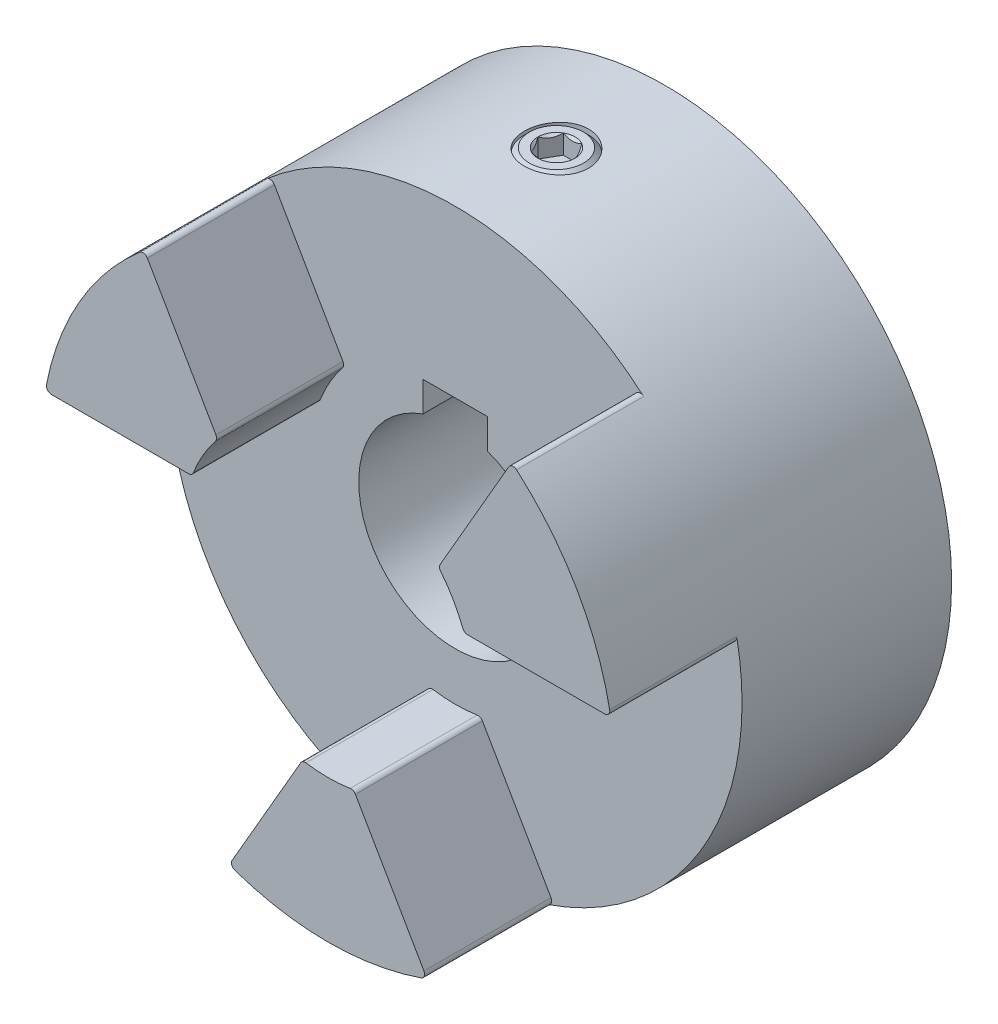
from build123d import *
from OCP.BRepFilletAPI import BRepFilletAPI_MakeChamfer

# Parameters (mm, degrees)
BOSS_EXTRUDE1_START      = -6.746875
SKETCH1_R                = 26.7890625
BOSS_EXTRUDE1_DEPTH      = 20.6375
BOSS_EXTRUDE2_DEPTH      = 11.8618
FILLET1_R                = 0.476990821
CIRPATTERN1_COUNT        = 3
FILLET1_OF_CIRPATTERN1_R = 0.476990821
CUT_EXTRUDE5_DEPTH       = 47.746248335
CUT_EXTRUDE5_DEPTH_BACK  = 47.746248335
SKETCH15_R               = 9
CHAMFER1_SIZE            = 1.0715625
CHAMFER1_SIZE2           = 1.588656738
CUT_EXTRUDE1_DEPTH       = 47.746248335
CUT_EXTRUDE1_DEPTH_BACK  = 47.746248335
SKETCH5_R                = 3
CUT_EXTRUDE2_DEPTH       = 47.746248335
SKETCH6_R                = 3
BOSS_EXTRUDE3_DEPTH      = 8
CUT_EXTRUDE3_DEPTH       = 1.8
CHAMFER3_SIZE            = 0.48
CHAMFER4_SIZE            = 1.02


with BuildPart() as part:
    # Sketch1 → Boss-Extrude1 (new body)
    with BuildSketch(Plane.XY.offset(BOSS_EXTRUDE1_START)):
        Circle(SKETCH1_R)
    extrude(amount=-BOSS_EXTRUDE1_DEPTH)

    # Sketch2 → Boss-Extrude2 (add)
    with BuildSketch(Plane.XY.offset(-6.746875)):
        with BuildLine():
            Line((-9.238549561, -25.145637229), (-2.384954104, -13.274861682))
            ThreePointArc((-2.384954104, -13.274861682), (0, -13.4874), (2.384954104, -13.274861682))
            Line((2.384954104, -13.274861682), (9.238549561, -25.145637229))
            ThreePointArc((9.238549561, -25.145637229), (0, -26.7890625), (-9.238549561, -25.145637229))
        make_face()
    boss_extrude2 = extrude(amount=BOSS_EXTRUDE2_DEPTH)

    # Fillet1
    # the kernel refuses this fillet: 0.476990821 mm, written as the material it takes off along each edge
    with BuildSketch(Plane(origin=(-9.238549561, -25.145637229, -6.746875), x_dir=(0.9423194959651416, -0.33471475546202245, 0), z_dir=(0, 0, 1))) as fillet1_piece_1:
        with BuildLine():
            CenterArc((0.572952448, 0.476963054), FILLET1_R, 169.55519331, 101.063030663)
            Line((0.103865366, 0.563435893), (0, 0))
            ThreePointArc((0, 0), (0.28904955, -0.001559444), (0.5780991, 0))
        make_face()
    extrude(amount=13.307047751, mode=Mode.SUBTRACT)
    with BuildSketch(Plane(origin=(9.238549561, -25.145637229, -6.746875), x_dir=(-0.9423194959651411, -0.3347147554620237, 0), z_dir=(0, 0, 1))) as fillet1_piece_2:
        with BuildLine():
            CenterArc((0.572952448, -0.476963054), FILLET1_R, 89.381776027, 101.063030663)
            Line((0.103865366, -0.563435893), (0, 0))
            ThreePointArc((0, 0), (0.28904955, 0.001559444), (0.5780991, 0))
        make_face()
    extrude(amount=13.307047751, mode=Mode.SUBTRACT)
    with BuildSketch(Plane(origin=(2.384954104, -13.274861682, -6.746875), x_dir=(0.49999999999999706, -0.8660254037844404, 0), z_dir=(0, 0, 1))) as fillet1_piece_3:
        with BuildLine():
            CenterArc((0.330829178, -0.476990821), FILLET1_R, 90, 68.803855098)
            ThreePointArc((-0.113892323, -0.304529143), (-0.056028498, -0.152607773), (0, 0))
            Line((0, 0), (0.330829178, 0))
        make_face()
    extrude(amount=12.688872944, mode=Mode.SUBTRACT)
    with BuildSketch(Plane(origin=(-2.384954104, -13.274861682, -6.746875), x_dir=(0.9863015455813384, -0.16495229972286882, 0), z_dir=(0, 0, 1))) as fillet1_piece_4:
        with BuildLine():
            CenterArc((0.330879129, -0.476956172), FILLET1_R, 90.690608377, 68.803855098)
            Line((-0.115888763, -0.309867293), (0, 0))
            ThreePointArc((0, 0), (0.162564956, -0.000979741), (0.325129912, 0))
        make_face()
    extrude(amount=12.688872944, mode=Mode.SUBTRACT)

    # CirPattern1: Boss-Extrude2 ×3 about axis
    cirpattern1_axis = Axis((0, 0, 0), (0, 0, 1))
    for i in range(1, CIRPATTERN1_COUNT):
        add(boss_extrude2.rotate(cirpattern1_axis, i * 360 / CIRPATTERN1_COUNT))

    # Fillet1 of CirPattern1
    # the kernel refuses this fillet: 0.476990821 mm, written as the material it takes off along each edge
    with BuildSketch(Plane(origin=(26.396035415, 4.572, -6.746875), x_dir=(-0.18128826673094764, 0.9834299997181745, 0), z_dir=(0, 0, 1)), Plane(origin=(-17.157485854, 20.573637229, -6.746875), x_dir=(-0.761031229234182, -0.6487152442561451, 0), z_dir=(0, 0, 1))) as fillet1_of_cirpattern1_piece_1:
        with BuildLine():
            CenterArc((0.572952448, 0.476963054), FILLET1_OF_CIRPATTERN1_R, 169.55519331, 101.063030663)
            Line((0.103865366, 0.563435893), (0, 0))
            ThreePointArc((0, 0), (0.28904955, -0.001559444), (0.5780991, 0))
        make_face()
    extrude(amount=13.307047751, mode=Mode.SUBTRACT)
    with BuildSketch(Plane(origin=(17.157485854, 20.573637229, -6.746875), x_dir=(0.7610312292341833, -0.6487152442561435, 0), z_dir=(0, 0, 1)), Plane(origin=(-26.396035415, 4.572, -6.746875), x_dir=(0.181288266730962, 0.9834299997181718, 0), z_dir=(0, 0, 1))) as fillet1_of_cirpattern1_piece_2:
        with BuildLine():
            CenterArc((0.572952448, -0.476963054), FILLET1_OF_CIRPATTERN1_R, 89.381776027, 101.063030663)
            Line((0.103865366, -0.563435893), (0, 0))
            ThreePointArc((0, 0), (0.28904955, 0.001559444), (0.5780991, 0))
        make_face()
    extrude(amount=13.307047751, mode=Mode.SUBTRACT)
    with BuildSketch(Plane(origin=(10.303890396, 8.702861682, -6.746875), x_dir=(0.5000000000000006, 0.8660254037844383, 0), z_dir=(0, 0, 1)), Plane(origin=(-12.688844501, 4.572, -6.746875), x_dir=(-1, 0, 0), z_dir=(0, 0, 1))) as fillet1_of_cirpattern1_piece_3:
        with BuildLine():
            CenterArc((0.330829178, -0.476990821), FILLET1_OF_CIRPATTERN1_R, 90, 68.803855098)
            ThreePointArc((-0.113892323, -0.304529143), (-0.056028498, -0.152607773), (0, 0))
            Line((0, 0), (0.330829178, 0))
        make_face()
    extrude(amount=12.688872944, mode=Mode.SUBTRACT)
    with BuildSketch(Plane(origin=(12.688844501, 4.572, -6.746875), x_dir=(-0.3502978908180006, 0.9366383441267288, 0), z_dir=(0, 0, 1)), Plane(origin=(-10.303890396, 8.702861682, -6.746875), x_dir=(-0.6360036547633316, -0.7716860444038657, 0), z_dir=(0, 0, 1))) as fillet1_of_cirpattern1_piece_4:
        with BuildLine():
            CenterArc((0.330879129, -0.476956172), FILLET1_OF_CIRPATTERN1_R, 90.690608377, 68.803855098)
            Line((-0.115888763, -0.309867293), (0, 0))
            ThreePointArc((0, 0), (0.162564956, -0.000979741), (0.325129912, 0))
        make_face()
    extrude(amount=12.688872944, mode=Mode.SUBTRACT)

    # Sketch15 → Cut-Extrude5 (cut, two sides: drawn at the far end of the back side and taken through both)
    with BuildSketch(Plane.XY.offset(-CUT_EXTRUDE5_DEPTH_BACK)):
        Circle(SKETCH15_R)
    extrude(amount=CUT_EXTRUDE5_DEPTH + CUT_EXTRUDE5_DEPTH_BACK, mode=Mode.SUBTRACT)

    # Chamfer1: one chamfer whose edges measure the first distance from different faces: ONE call of the kernel's chamfer builder (chamfer() names one face for all edges)
    chamfer1_edges_1 = [part.edges().sort_by_distance(p)[0] for p in [
        (-26.7890625, 0, -27.384375),
    ]]
    chamfer1_side_1 = [part.faces().sort_by_distance(p)[0] for p in [
        (-26.7890625, 0, -17.065625),
    ]]
    chamfer1_edges_2 = [part.edges().sort_by_distance(p)[0] for p in [
        (-9, 0, -27.384375),
    ]]
    chamfer1_side_2 = [part.faces().sort_by_distance(p)[0] for p in [
        (-9, 0, -17.065625),
    ]]
    chamfer1 = BRepFilletAPI_MakeChamfer(part.part.solid().wrapped)
    for e in chamfer1_edges_1:
        chamfer1.Add(CHAMFER1_SIZE, CHAMFER1_SIZE2, e.wrapped, chamfer1_side_1[0].wrapped)  # the first distance lies on this face
    for e in chamfer1_edges_2:
        chamfer1.Add(CHAMFER1_SIZE, CHAMFER1_SIZE2, e.wrapped, chamfer1_side_2[0].wrapped)  # the first distance lies on this face
    add(Compound.cast(chamfer1.Shape()), mode=Mode.REPLACE)

    # Sketch4 → Cut-Extrude1 (cut, two sides: drawn at the far end of the back side and taken through both)
    with BuildSketch(Plane.XY.offset(-CUT_EXTRUDE1_DEPTH_BACK)):
        with BuildLine():
            Line((-3, 11.285281374), (3, 11.285281374))
            Line((3, 11.285281374), (3, 8.485281374))
            ThreePointArc((3, 8.485281374), (0, 9), (-3, 8.485281374))
            Line((-3, 8.485281374), (-3, 11.285281374))
        make_face()
    extrude(amount=CUT_EXTRUDE1_DEPTH + CUT_EXTRUDE1_DEPTH_BACK, mode=Mode.SUBTRACT)

    # Sketch5 → Cut-Extrude2 (cut, through all)
    with BuildSketch(Plane(origin=(0, 0, 0), x_dir=(1, 0, 0), z_dir=(0, 1, 0))):
        with Locations(Location((0, 16.208375, 0), (0, 0, 90))):
            Circle(SKETCH5_R)
    extrude(amount=CUT_EXTRUDE2_DEPTH, mode=Mode.SUBTRACT)


with BuildPart() as body_2:
    # Sketch6 → Boss-Extrude3 (new body)
    with BuildSketch(Plane(origin=(0, 26.7890625, 0), x_dir=(-1, 0, 0), z_dir=(0, 1, 0))):
        with Locations(Location((0, -16.208375, 0), (0, 0, 90))):
            Circle(SKETCH6_R)
    extrude(amount=-BOSS_EXTRUDE3_DEPTH)

    # Sketch8 → Cut-Extrude3 (cut)
    with BuildSketch(Plane(origin=(0, 26.7890625, 0), x_dir=(1, 0, 0), z_dir=(0, 1, 0))):
        Polygon((0.866025404, 14.708375), (1.732050808, 16.208375), (0.866025404, 17.708375), (-0.866025404, 17.708375), (-1.732050808, 16.208375), (-0.866025404, 14.708375), align=None)
    extrude(amount=-CUT_EXTRUDE3_DEPTH, mode=Mode.SUBTRACT)

    # Cut-Extrude4 cone 1 section (through the dimple's axis) → Cut-Extrude4 (revolve, cut)
    with BuildSketch(Plane(origin=(0, 26.7890625, -16.208375), x_dir=(0, 0, 1), z_dir=(1, 0, 0))):
        Polygon((0, 0), (1.732050808, 0), (0, 1.732050808), align=None)
    revolve(axis=Axis((0, 26.7890625, -16.208375), (0, -1, 0)), mode=Mode.SUBTRACT)

    # Chamfer3
    chamfer3_edges = [body_2.edges().sort_by_distance(p)[0] for p in [
        (0, 26.7890625, -19.208375),
    ]]
    chamfer(chamfer3_edges, length=CHAMFER3_SIZE)

    # Chamfer4
    chamfer4_edges = [body_2.edges().sort_by_distance(p)[0] for p in [
        (0, 18.7890625, -19.208375),
    ]]
    chamfer(chamfer4_edges, length=CHAMFER4_SIZE)


solid = Compound([part.part, body_2.part])
